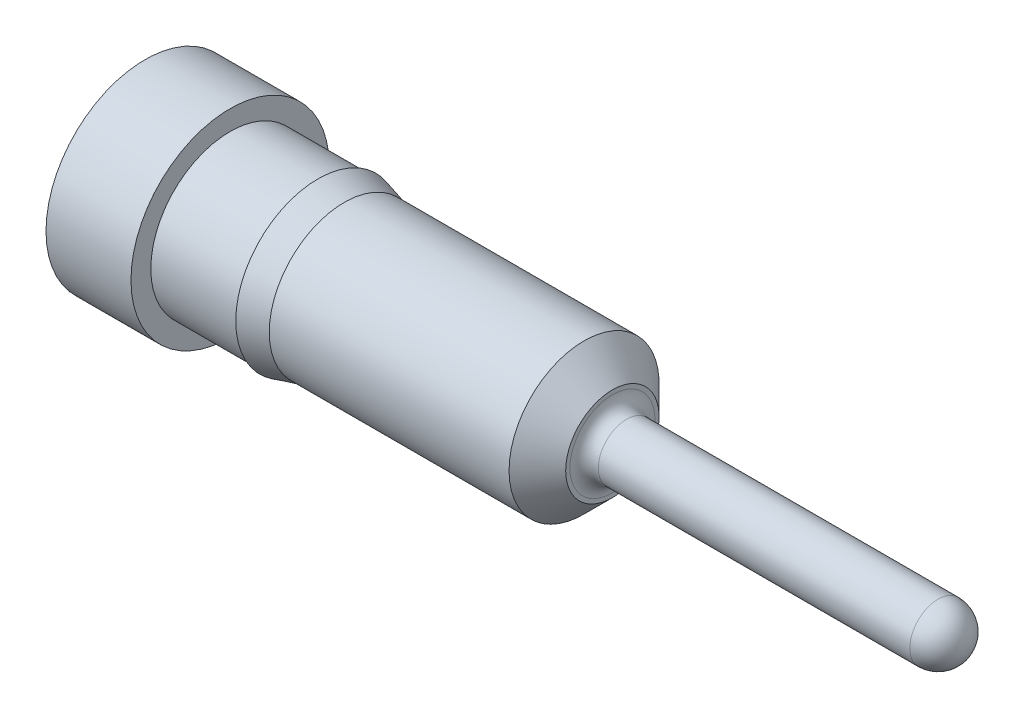
from build123d import *


# Read off the part's stored shape, not the designer's step: Hole1
with BuildPart() as part:
    # Sketch1 → RevolutionAngle1 (revolve)
    with BuildSketch(Plane.XY, mode=Mode.PRIVATE) as revolutionangle1_sk:
        with BuildLine():
            Line((4.191, 0.4191), (4.191, 0.381))
            ThreePointArc((4.191, 0.381), (4.228197439, 0.291197439), (4.318, 0.254))
            Line((4.318, 0.254), (7.112, 0.254))
            ThreePointArc((7.112, 0.254), (7.291605122, 0.179605122), (7.366, 0))
            Line((7.366, 0), (0, 0))
            Line((0, 0), (0, 0.889))
            Line((0, 0.889), (0.762, 0.889))
            Line((0.762, 0.889), (0.762, 0.7112))
            Line((0.762, 0.7112), (1.5494, 0.7112))
            Line((1.5494, 0.7112), (1.5494, 0.7366))
            Line((1.5494, 0.7366), (1.786385226, 0.6731))
            Line((1.786385226, 0.6731), (3.937, 0.6731))
            Line((3.937, 0.6731), (4.191, 0.4191))
        make_face()
    revolve(revolutionangle1_sk.sketch.rotate(Axis((0, 0, 0), (1, 0, 0)), 90), axis=Axis((0, 0, 0), (1, 0, 0)))

    # Hole1 outline → Hole1 (revolve, cut)
    with BuildSketch(Plane.YX):
        Polygon((0.8128, 0.000254), (0, 0.362135875), (0, 0), (0.8128, 0), align=None)
    revolve(axis=Axis((0, 0, 0), (1, 0, 0)), mode=Mode.SUBTRACT)


solid = part.part
